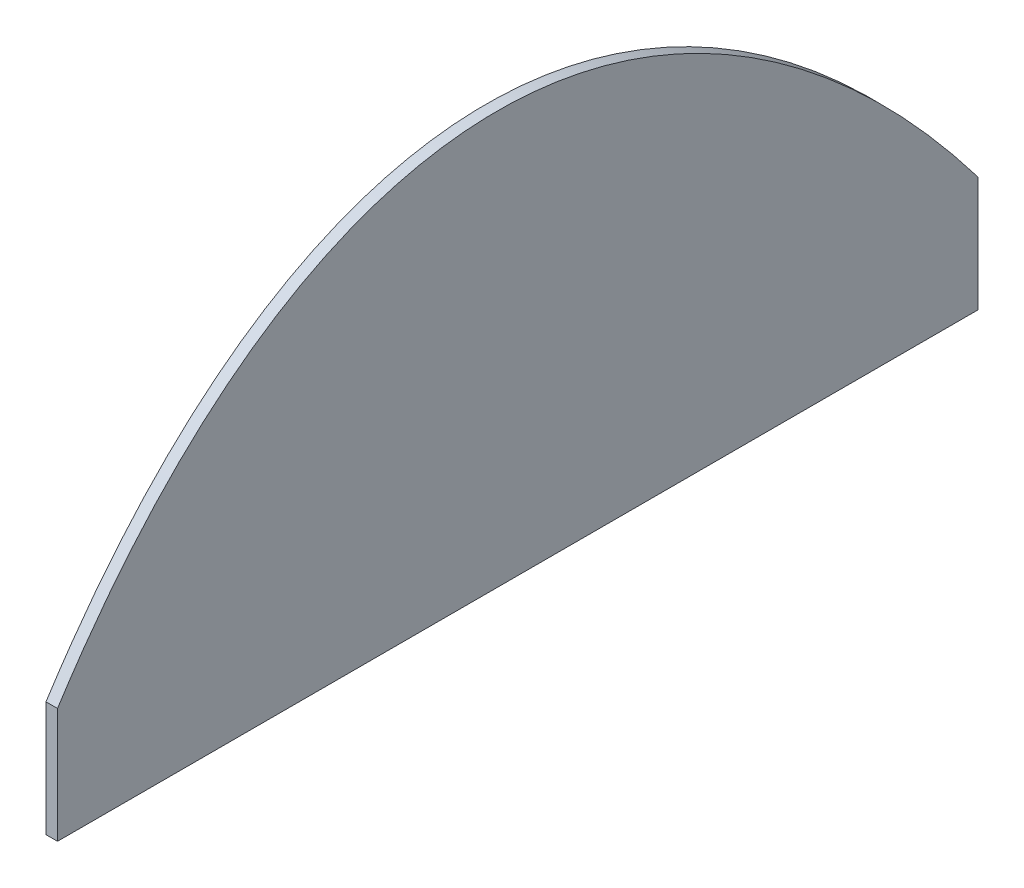
from build123d import *

# Parameters (mm, degrees)
THICKEN1_DEPTH      = 1
SKETCH6_W           = 3
SKETCH6_H           = 3
BOSS_EXTRUDE1_DEPTH = 10


# Read off the part's stored shape, not the designer's step: Thicken1
with BuildPart() as part:
    # Thicken1 outline → Thicken1 (new body)
    with BuildSketch(Plane.YZ):
        with BuildLine():
            add(Edge.make_bspline(
                [(10, -80), (41.657742077, -55.94021324), (47.197734967, -23.837728835), (10, 0)],
                knots=[0, 0, 0, 0, 1, 1, 1, 1], degree=3))
            Line((10, 0), (0, 0))
            Line((0, 0), (0, -80))
            Line((0, -80), (10, -80))
        make_face()
    extrude(amount=THICKEN1_DEPTH)

    # Sketch6 → Boss-Extrude1 (add)
    with BuildSketch(Plane.ZY):
        with Locations((-38.250665785, 1.5)):
            Rectangle(SKETCH6_W, SKETCH6_H)
    extrude(amount=BOSS_EXTRUDE1_DEPTH)


solid = part.part
